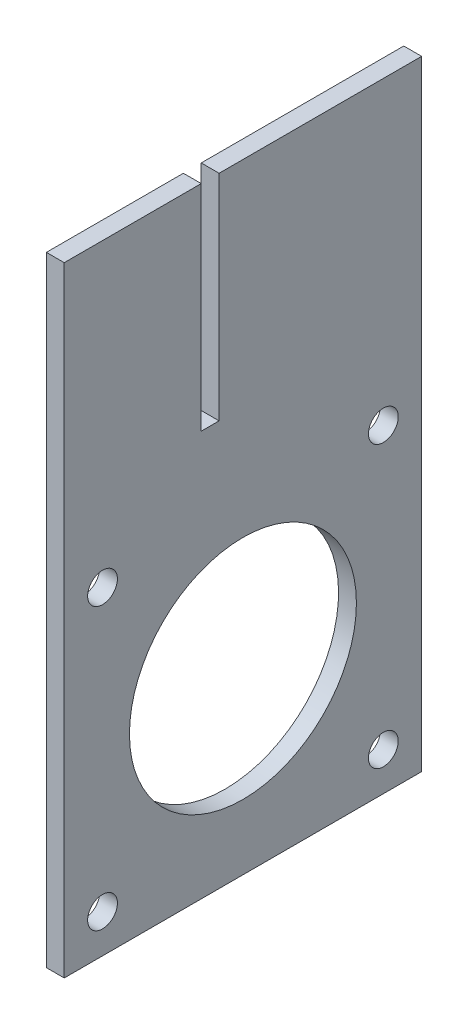
from build123d import *

# Parameters (mm, degrees)
SKETCH2_W          = 3
SKETCH2_H          = 104
BASE_FLANGE1_DEPTH = 60
SKETCH4_R          = 2.5
SKETCH4_R_2        = 19.05
CUT_EXTRUDE2_DEPTH = 10
SKETCH5_W          = 3
SKETCH5_H          = 36
CUT_EXTRUDE4_DEPTH = 10


# Sheet-metal steps are written as plain solids
with BuildPart() as part:
    # Sketch2 → Base-Flange1 (new body)
    with BuildSketch(Plane.XY):
        with Locations((-1.5, 52)):
            Rectangle(SKETCH2_W, SKETCH2_H)
    extrude(amount=BASE_FLANGE1_DEPTH)

    # Sketch4 → Cut-Extrude2 (cut)
    with BuildSketch(Plane.ZY.offset(3)):
        with Locations(Location((6.43, 6.43, 0), (0, 0, 270))):
            Circle(SKETCH4_R)
        with Locations(Location((30, 30, 0), (0, 0, 270))):
            Circle(SKETCH4_R_2)
        with Locations(Location((6.43, 53.57, 0), (0, 0, 270))):
            Circle(SKETCH4_R)
        with Locations(Location((53.57, 6.43, 0), (0, 0, 270))):
            Circle(SKETCH4_R)
        with Locations(Location((53.57, 53.57, 0), (0, 0, 270))):
            Circle(SKETCH4_R)
    extrude(amount=-CUT_EXTRUDE2_DEPTH, mode=Mode.SUBTRACT)

    # Sketch5 → Cut-Extrude4 (cut)
    with BuildSketch(Plane.ZY.offset(3)):
        with Locations((35.5, 86)):
            Rectangle(SKETCH5_W, SKETCH5_H)
    extrude(amount=-CUT_EXTRUDE4_DEPTH, mode=Mode.SUBTRACT)


solid = part.part
